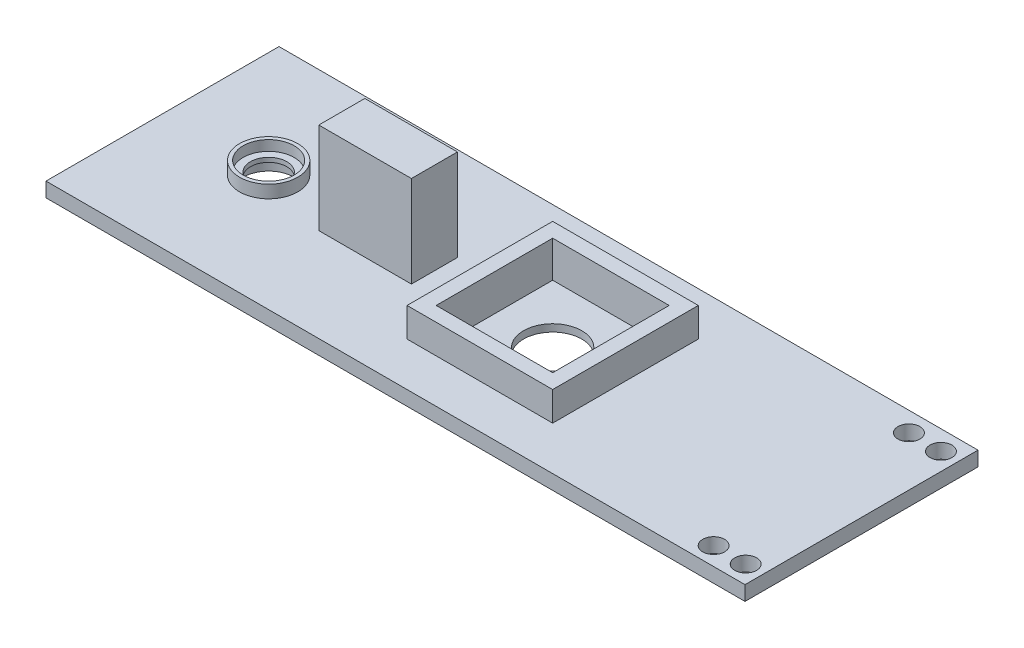
from build123d import *

# Parameters (mm, degrees)
SKETCH1_W           = 304.8
SKETCH1_H           = 101.6
BOSS_EXTRUDE1_DEPTH = 6.35
SKETCH2_R           = 12.7
BOSS_EXTRUDE3_DEPTH = 5.55625
SKETCH9_R           = 11.1125
CUT_EXTRUDE4_DEPTH  = 4.445
CUT_EXTRUDE5_START  = -5.55625
SKETCH10_R          = 11.1125
CUT_EXTRUDE5_DEPTH  = 5.55625
SKETCH11_R          = 7.9375
CUT_EXTRUDE6_DEPTH  = 310.094403462
SKETCH12_R          = 12.7
CUT_EXTRUDE7_DEPTH  = 310.0695755
SKETCH22_W          = 63.5
SKETCH22_H          = 63.5
BOSS_EXTRUDE7_DEPTH = 12.7
SKETCH25_W          = 50.8
SKETCH25_H          = 50.8
CUT_EXTRUDE11_DEPTH = 15.875
SKETCH18_W          = 40.386
SKETCH18_H          = 20.066
BOSS_EXTRUDE5_DEPTH = 39.878
SKETCH32_R          = 4.7625
CUT_EXTRUDE12_DEPTH = 6.35


with BuildPart() as part:
    # Sketch1 → Boss-Extrude1 (new body)
    with BuildSketch(Plane(origin=(0, 0, 0), x_dir=(1, 0, 0), z_dir=(0, 1, 0))):
        with Locations((-152.4, 0)):
            Rectangle(SKETCH1_W, SKETCH1_H)
    extrude(amount=BOSS_EXTRUDE1_DEPTH)

    # Sketch2 → Boss-Extrude3 (add)
    with BuildSketch(Plane(origin=(0, 6.35, 0), x_dir=(1, 0, 0), z_dir=(0, 1, 0))):
        with Locations((-258.510557857, 0)):
            Circle(SKETCH2_R)
    extrude(amount=BOSS_EXTRUDE3_DEPTH)

    # Sketch9 → Cut-Extrude4 (cut)
    with BuildSketch(Plane(origin=(0, 11.90625, 0), x_dir=(1, 0, 0), z_dir=(0, 1, 0))):
        with Locations((-258.510557857, 0)):
            Circle(SKETCH9_R)
    extrude(amount=-CUT_EXTRUDE4_DEPTH, mode=Mode.SUBTRACT)

    # Sketch10 → Cut-Extrude5 (cut)
    with BuildSketch(Plane(origin=(0, 0, 0), x_dir=(-1, 0, 0), z_dir=(0, -1, 0)).offset(CUT_EXTRUDE5_START)):
        with Locations((258.510557857, 0)):
            Circle(SKETCH10_R)
    extrude(amount=CUT_EXTRUDE5_DEPTH, mode=Mode.SUBTRACT)

    # Sketch11 → Cut-Extrude6 (cut, through all)
    with BuildSketch(Plane(origin=(0, 7.46125, 0), x_dir=(1, 0, 0), z_dir=(0, 1, 0))):
        with Locations((-258.510557857, 0)):
            Circle(SKETCH11_R)
    extrude(amount=-CUT_EXTRUDE6_DEPTH, mode=Mode.SUBTRACT)

    # Sketch12 → Cut-Extrude7 (cut, through all)
    with BuildSketch(Plane(origin=(0, 6.35, 0), x_dir=(1, 0, 0), z_dir=(0, 1, 0))):
        with Locations((-134.666203771, 0)):
            Circle(SKETCH12_R)
    extrude(amount=-CUT_EXTRUDE7_DEPTH, mode=Mode.SUBTRACT)

    # Sketch22 → Boss-Extrude7 (add)
    with BuildSketch(Plane(origin=(0, 6.35, 0), x_dir=(1, 0, 0), z_dir=(0, 1, 0))):
        with Locations((-134.666203771, 0)):
            Rectangle(SKETCH22_W, SKETCH22_H)
    extrude(amount=BOSS_EXTRUDE7_DEPTH)

    # Sketch25 → Cut-Extrude11 (cut)
    with BuildSketch(Plane(origin=(0, 19.05, 0), x_dir=(1, 0, 0), z_dir=(0, 1, 0))):
        with Locations((-134.666203771, 0)):
            Rectangle(SKETCH25_W, SKETCH25_H)
    extrude(amount=-CUT_EXTRUDE11_DEPTH, mode=Mode.SUBTRACT)

    # Sketch18 → Boss-Extrude5 (add)
    with BuildSketch(Plane(origin=(0, 6.35, 0), x_dir=(1, 0, 0), z_dir=(0, 1, 0))):
        with Locations((-206.419013169, 0)):
            Rectangle(SKETCH18_W, SKETCH18_H)
    extrude(amount=BOSS_EXTRUDE5_DEPTH)

    # Sketch32 → Cut-Extrude12 (cut)
    with BuildSketch(Plane(origin=(0, 6.35, 0), x_dir=(1, 0, 0), z_dir=(0, 1, 0))):
        with Locations((-7.62, -42.893773539)):
            Circle(SKETCH32_R)
        with Locations((-21.59, -42.893773539)):
            Circle(SKETCH32_R)
        with Locations((-7.62, 42.272941973)):
            Circle(SKETCH32_R)
        with Locations((-21.59, 42.272941973)):
            Circle(SKETCH32_R)
    extrude(amount=-CUT_EXTRUDE12_DEPTH, mode=Mode.SUBTRACT)


solid = part.part
